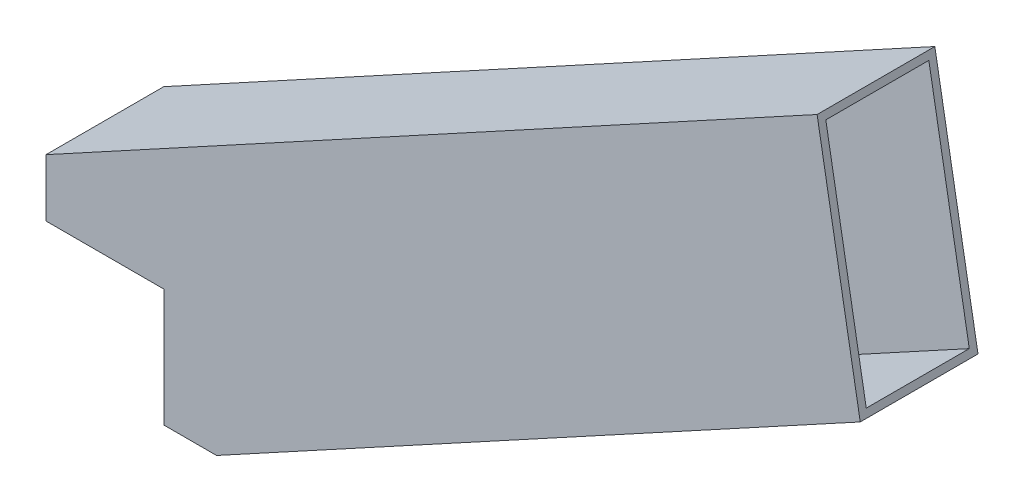
from build123d import *

# Parameters (mm, degrees)
BOSS_EXTRUDE1_DEPTH = 25.4
SHELL1_T            = -1.5875


with BuildPart() as part:
    # Sketch1 → Boss-Extrude1 (new body)
    with BuildSketch(Plane.XY):
        Polygon((144.10436, 131.64058), (-22.225, 40.975970561), (-22.225, 28.575), (3.175, 28.575), (3.175, 3.175), (14.568567723, 3.175), (153.411525172, 78.857023369), align=None)
    extrude(amount=BOSS_EXTRUDE1_DEPTH)

    # Shell1
    shell1_openings = [part.faces().sort_by_distance(p)[0] for p in [
        (-9.525, 28.575, 12.7),
        (3.175, 15.875, 12.7),
        (148.757942586, 105.248801685, 12.7),
        (8.871783861, 3.175, 12.7),
        (-22.225, 34.77548528, 12.7),
    ]]
    offset(amount=SHELL1_T, openings=shell1_openings, kind=Kind.INTERSECTION)


solid = part.part
